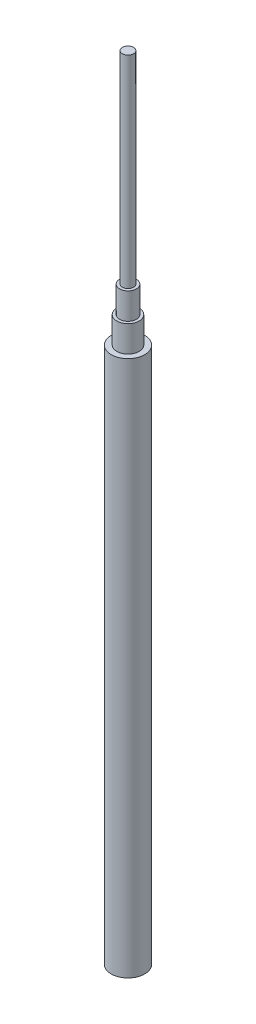
from build123d import *

# Parameters (mm, degrees)
SKETCH1_R           = 4.7625
BOSS_EXTRUDE1_DEPTH = 152.5
SKETCH2_R           = 3.175
BOSS_EXTRUDE2_DEPTH = 160
SKETCH3_R           = 2.38125
BOSS_EXTRUDE3_DEPTH = 167.5
SKETCH4_R           = 1.5875
BOSS_EXTRUDE4_DEPTH = 225


with BuildPart() as part:
    # Sketch1 → Boss-Extrude1 (new body)
    with BuildSketch(Plane(origin=(0, 0, 0), x_dir=(1, 0, 0), z_dir=(0, 1, 0))):
        Circle(SKETCH1_R)
    extrude(amount=BOSS_EXTRUDE1_DEPTH)

    # Sketch2 → Boss-Extrude2 (add)
    with BuildSketch(Plane(origin=(0, 0, 0), x_dir=(1, 0, 0), z_dir=(0, 1, 0))):
        Circle(SKETCH2_R)
    extrude(amount=BOSS_EXTRUDE2_DEPTH)

    # Sketch3 → Boss-Extrude3 (add)
    with BuildSketch(Plane(origin=(0, 0, 0), x_dir=(1, 0, 0), z_dir=(0, 1, 0))):
        Circle(SKETCH3_R)
    extrude(amount=BOSS_EXTRUDE3_DEPTH)

    # Sketch4 → Boss-Extrude4 (add)
    with BuildSketch(Plane(origin=(0, 0, 0), x_dir=(1, 0, 0), z_dir=(0, 1, 0))):
        Circle(SKETCH4_R)
    extrude(amount=BOSS_EXTRUDE4_DEPTH)


solid = part.part
